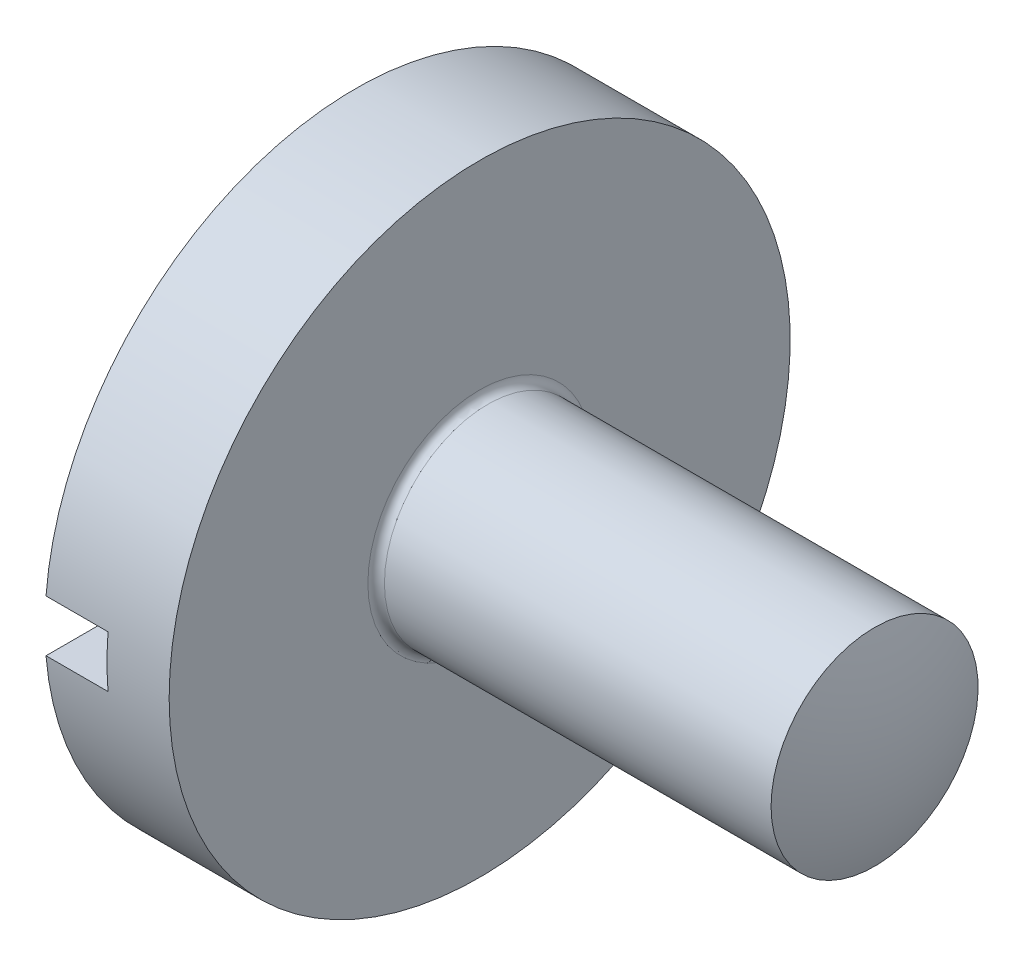
from build123d import *

# Parameters (mm, degrees)
SLOT_DEPTH      = 34.555923471
SLOT_DEPTH_BACK = 34.555923471
SKETCH2_W       = 3
SKETCH2_H       = 2.5


with BuildPart() as part:
    # Sketch1 → Base (revolve)
    with BuildSketch(Plane.XY):
        with BuildLine():
            Line((0, 0), (0, 15))
            Line((0, 15), (6, 15))
            Line((6, 15), (6, 5.4))
            ThreePointArc((6, 5.4), (6.117157288, 5.117157288), (6.4, 5))
            Line((6.4, 5), (25.076696831, 5))
            ThreePointArc((25.076696831, 5), (25.767239295, 2.542267135), (26, 0))
            Line((26, 0), (0, 0))
        make_face()
    revolve(axis=Axis((-64.356179775, 0, 0), (1, 0, 0)))

    # Sketch2 → Slot (cut, two sides: drawn at the far end of the back side and taken through both)
    with BuildSketch(Plane.XY.offset(-SLOT_DEPTH_BACK)):
        with Locations((1.5, 0)):
            Rectangle(SKETCH2_W, SKETCH2_H)
    extrude(amount=SLOT_DEPTH + SLOT_DEPTH_BACK, mode=Mode.SUBTRACT)


solid = part.part
